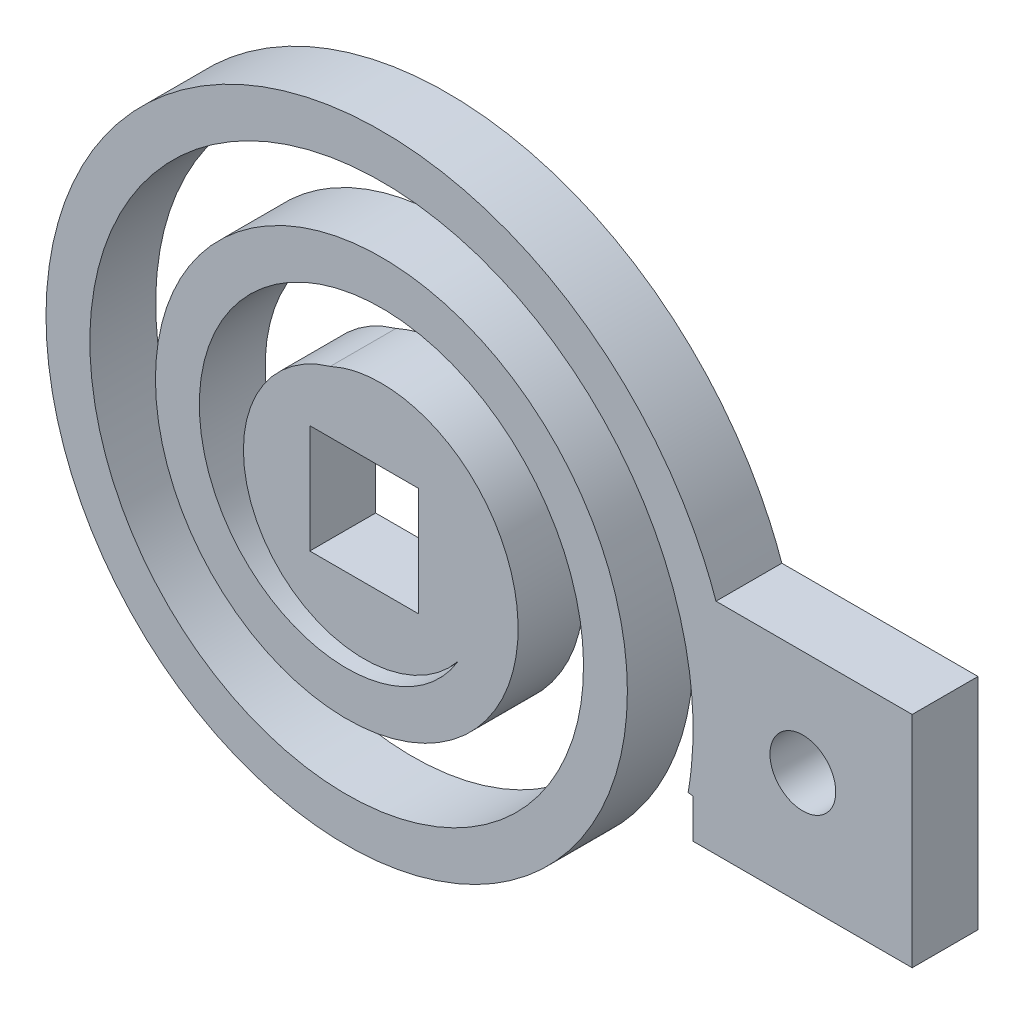
from build123d import *

# Parameters (mm, degrees)
BALAYAGE1_START  = -3
BALAYAGE1_DEPTH  = 3
ESQUISSE5_W      = 2
ESQUISSE5_H      = 3
EXTRUSION1_DEPTH = 4
ESQUISSE8_R      = 5.5
ESQUISSE8_W      = 10
ESQUISSE8_H      = 10
EXTRUSION2_DEPTH = 3
ESQUISSE9_R      = 1.5
ESQUISSE9_W      = 4.949747468
ESQUISSE9_H      = 4.949747468
EXTRUSION3_DEPTH = 30.683713673


# Read off the part's stored shape, not the designer's step: Balayage1
with BuildPart() as part:
    # Balayage1 outline → Balayage1 (new body)
    with BuildSketch(Plane.XY.offset(BALAYAGE1_START)):
        with BuildLine():
            Line((2.098663599, -0.46176203), (0.123522615, -0.776115481))
            add(Edge.make_bspline(
                [(0.123522615, -0.776115481), (0.119570945, -0.779541607), (0.116841063, -0.801624896), (0.0975614, -0.85668256), (0.079206465, -0.900433427), (0.019116685, -0.990384752), (-0.027528733, -1.045673964), (-0.148833871, -1.145674178), (-0.230781439, -1.197271691), (-0.421065415, -1.275060008), (-0.538243323, -1.305436912), (-0.790758643, -1.326771744), (-0.935598067, -1.31897245), (-1.229220073, -1.253335884), (-1.387268782, -1.193813973), (-1.688620492, -1.019723711), (-1.840120777, -0.900805212), (-2.107459984, -0.610094385), (-2.229719765, -0.431764496), (-2.418157895, -0.032288199), (-2.488450517, 0.196934301), (-2.555911758, 0.680543462), (-2.554573079, 0.943782939), (-2.467802028, 1.47147721), (-2.381161243, 1.744752711), (-2.121060571, 2.26448101), (-1.943848091, 2.518935205), (-1.509479191, 2.971801175), (-1.246401147, 3.176695335), (-0.657106892, 3.503349942), (-0.323357379, 3.62951923), (0.381344739, 3.777117066), (0.760753461, 3.800516307), (1.523625971, 3.729473328), (1.915709359, 3.634417198), (2.666460941, 3.324195536), (3.033148633, 3.105912639), (3.694926531, 2.55912899), (3.996734086, 2.225306189), (4.493840621, 1.469608999), (4.693974098, 1.040695902), (4.960043765, 0.128070209), (5.028521057, -0.363764724), (5.014307751, -1.360347881), (4.931658241, -1.873580254), (4.61158103, -2.865975608), (4.371707666, -3.353237249), (3.748391318, -4.245935559), (3.360245987, -4.658377544), (2.46646316, -5.357619951), (1.95429181, -5.649724951), (0.851952915, -6.073057278), (0.254001961, -6.207433387), (-0.969875767, -6.292747761), (-1.604148351, -6.244414658), (-2.844256393, -5.957530752), (-3.458267977, -5.717236422), (-4.600076718, -5.057175697), (-5.135167071, -4.633357133), (-6.065467866, -3.634654225), (-6.466455902, -3.053772655), (-7.084407032, -1.78543258), (-7.305134435, -1.090562799), (-7.532746496, 0.34841253), (-7.541061918, 1.100691911), (-7.332063144, 2.588948779), (-7.113730208, 3.33314777), (-6.459862064, 4.737214154), (-6.020956025, 5.404634726), (-4.954957034, 6.590878731), (-4.322442528, 7.115931984), (-2.917267116, 7.963174424), (-2.137612246, 8.289732511), (-0.501776106, 8.701331307), (0.362358472, 8.788506009), (2.093045811, 8.702728757), (2.967817072, 8.529497227), (4.641513018, 7.927111256), (5.448206615, 7.495295061), (6.910356841, 6.403524808), (7.572459382, 5.73876477), (8.680010792, 4.231076997), (9.130408706, 3.381622214), (9.76561158, 1.573173827), (9.95324376, 0.606503192), (10.035726085, -1.354509225), (9.931041877, -2.357008956), (9.426948831, -4.301461932), (9.025609686, -5.251345241), (7.952829611, -7.003776092), (7.277235745, -7.813338755), (5.706063134, -9.207749507), (4.804474226, -9.798091865), (2.853462563, -10.693548247), (1.796697699, -11.002163126), (-0.376105069, -11.296732523), (-1.500177774, -11.283895775), (-3.709980792, -10.925568218), (-4.803740998, -10.578894532), (-6.854724832, -9.572361265), (-7.819278008, -8.909034981), (-9.521935421, -7.317542409), (-10.266035733, -6.383930779), (-11.454604136, -4.3258554), (-11.903218608, -3.194443355), (-12.45160679, -0.834708368), (-12.553322213, 0.401461217), (-12.388017152, 2.864527266), (-12.12057028, 4.099487786), (-11.22923579, 6.450809979), (-10.602595453, 7.574754921), (-9.03742655, 9.601290037), (-8.094061797, 10.510327624), (-5.969408245, 12.02032189), (-4.781622291, 12.626034709), (-2.265903389, 13.467024105), (-0.930377516, 13.704957558), (1.76716748, 13.778832184), (3.137216572, 13.615105325), (5.783909405, 12.888773647), (7.068325029, 12.324151677), (9.428118855, 10.834695215), (10.510339467, 9.905673332), (12.364847373, 7.759349174), (13.142457911, 6.536055333), (14.311068079, 3.901043082), (14.705414555, 2.482050155), (15.062646927, -0.424595604), (15.026622205, -1.920145212), (14.770844841, -3.385270744)],
                knots=[0, 0, 0, 0, 0.015625, 0.015625, 0.03125, 0.03125, 0.046875, 0.046875, 0.0625, 0.0625, 0.078125, 0.078125, 0.09375, 0.09375, 0.109375, 0.109375, 0.125, 0.125, 0.140625, 0.140625, 0.15625, 0.15625, 0.171875, 0.171875, 0.1875, 0.1875, 0.203125, 0.203125, 0.21875, 0.21875, 0.234375, 0.234375, 0.25, 0.25, 0.265625, 0.265625, 0.28125, 0.28125, 0.296875, 0.296875, 0.3125, 0.3125, 0.328125, 0.328125, 0.34375, 0.34375, 0.359375, 0.359375, 0.375, 0.375, 0.390625, 0.390625, 0.40625, 0.40625, 0.421875, 0.421875, 0.4375, 0.4375, 0.453125, 0.453125, 0.46875, 0.46875, 0.484375, 0.484375, 0.5, 0.5, 0.515625, 0.515625, 0.53125, 0.53125, 0.546875, 0.546875, 0.5625, 0.5625, 0.578125, 0.578125, 0.59375, 0.59375, 0.609375, 0.609375, 0.625, 0.625, 0.640625, 0.640625, 0.65625, 0.65625, 0.671875, 0.671875, 0.6875, 0.6875, 0.703125, 0.703125, 0.71875, 0.71875, 0.734375, 0.734375, 0.75, 0.75, 0.765625, 0.765625, 0.78125, 0.78125, 0.796875, 0.796875, 0.8125, 0.8125, 0.828125, 0.828125, 0.84375, 0.84375, 0.859375, 0.859375, 0.875, 0.875, 0.890625, 0.890625, 0.90625, 0.90625, 0.921875, 0.921875, 0.9375, 0.9375, 0.953125, 0.953125, 0.96875, 0.96875, 0.984375, 0.984375, 1, 1, 1, 1], degree=3))
            Line((14.770844841, -3.385270744), (16.748248511, -3.685061879))
            add(Edge.make_bspline(
                [(2.098663599, -0.46176203), (2.129630148, -0.684585885), (2.124981067, -0.923442707), (2.032372753, -1.408017477), (1.944357309, -1.653637163), (1.681879935, -2.122339402), (1.507396908, -2.345307697), (1.079148696, -2.738502757), (0.825401597, -2.908611426), (0.25614759, -3.16862501), (-0.059302074, -3.25842113), (-0.725219387, -3.336556884), (-1.075594964, -3.32480968), (-1.777671245, -3.187808192), (-2.129253363, -3.062499824), (-2.796304814, -2.697687681), (-3.111640586, -2.458170298), (-3.668857568, -1.876659015), (-3.910603908, -1.534695699), (-4.287488846, -0.772173533), (-4.422505689, -0.35168863), (-4.560882855, 0.533413521), (-4.564148235, 0.997918916), (-4.425388678, 1.928836294), (-4.283307124, 2.395108212), (-3.853955788, 3.283399666), (-3.566675767, 3.705264013), (-2.861798087, 4.459140797), (-2.444240189, 4.790998192), (-1.508011543, 5.324545488), (-0.989429201, 5.526096466), (0.107246046, 5.768480082), (0.685208295, 5.809204987), (1.849965689, 5.712914668), (2.436598914, 5.575835505), (3.563389104, 5.123070388), (4.103367543, 4.807373056), (5.082083612, 4.013821808), (5.520643115, 3.536012968), (6.247728365, 2.451509539), (6.536094129, 1.844914914), (6.925119862, 0.550740613), (7.025654742, -0.136691305), (7.016814166, -1.533764336), (6.907362573, -2.243222035), (6.47488662, -3.619722817), (6.151844946, -4.286563016), (5.308506267, -5.513226761), (4.78825532, -6.072846763), (3.586375818, -7.026670398), (2.904855264, -7.420689522), (1.433548891, -7.997019971), (0.643925514, -8.179184523), (-0.97733681, -8.302669946), (-1.808771957, -8.243897631), (-3.439827853, -7.877191544), (-4.23922106, -7.569229534), (-5.731333916, -6.718507483), (-6.423822908, -6.175789759), (-7.633203283, -4.892405344), (-8.149882667, -4.151850618), (-8.95138808, -2.529799829), (-9.236041646, -1.648477802), (-9.535761532, 0.182272453), (-9.550712884, 1.131478345), (-9.296199226, 3.015345563), (-9.026689972, 3.949755139), (-8.213767995, 5.718760713), (-7.670388822, 6.553097944), (-6.345763661, 8.0418278), (-5.564629037, 8.695978556), (-3.823870373, 9.75695395), (-2.864428233, 10.163576853), (-0.845333633, 10.681614692), (0.214080538, 10.792888374), (2.342309281, 10.697071429), (3.410849113, 10.489915481), (5.46177438, 9.761965032), (6.443872679, 9.241190079), (8.230148699, 7.919324843), (9.034052951, 7.11834035), (10.384483216, 5.296092615), (10.930775147, 4.275014832), (11.706551085, 2.094924245), (11.935863368, 0.936162398), (12.044457026, -1.421260098), (11.923647036, -2.619625001), (11.3289944, -4.950819408), (10.855151951, -6.083333913), (9.583059171, -8.17926816), (8.784903756, -9.142381809), (6.923012596, -10.807265762), (5.859461049, -11.508767149), (3.551588111, -12.578230665), (2.307526403, -12.945986834), (-0.25729886, -13.303042975), (-1.577748397, -13.292220788), (-4.180725436, -12.879483778), (-5.462911367, -12.477544444), (-7.874132319, -11.304465597), (-9.002828349, -10.533404592), (-11.001571984, -8.67770551), (-11.871314001, -7.593245109), (-13.26617953, -5.196231204), (-13.791059582, -3.883941553), (-14.438109518, -1.139926653), (-14.560122009, 0.291469773), (-14.377328689, 3.150854227), (-14.072468392, 4.578476193), (-13.04904344, 7.303825942), (-12.330535215, 8.601182345), (-10.530143415, 10.947070634), (-9.448425381, 11.995259143), (-7.005809409, 13.742296031), (-5.645174401, 14.440860776), (-2.756299599, 15.416082195), (-1.228399282, 15.692542216), (1.865183386, 15.786244103), (3.430478047, 15.603396444), (6.461810962, 14.780797253), (7.927446768, 14.14107437), (10.627202402, 12.447610857), (11.860940713, 11.394017754), (13.981328239, 8.953619846), (14.867651634, 7.56707148), (16.205073248, 4.573376393), (16.655932023, 2.966575004), (17.070324415, -0.332325267), (17.033728693, -2.024018404), (16.748248511, -3.685061879)],
                knots=[0, 0, 0, 0, 0.015625, 0.015625, 0.03125, 0.03125, 0.046875, 0.046875, 0.0625, 0.0625, 0.078125, 0.078125, 0.09375, 0.09375, 0.109375, 0.109375, 0.125, 0.125, 0.140625, 0.140625, 0.15625, 0.15625, 0.171875, 0.171875, 0.1875, 0.1875, 0.203125, 0.203125, 0.21875, 0.21875, 0.234375, 0.234375, 0.25, 0.25, 0.265625, 0.265625, 0.28125, 0.28125, 0.296875, 0.296875, 0.3125, 0.3125, 0.328125, 0.328125, 0.34375, 0.34375, 0.359375, 0.359375, 0.375, 0.375, 0.390625, 0.390625, 0.40625, 0.40625, 0.421875, 0.421875, 0.4375, 0.4375, 0.453125, 0.453125, 0.46875, 0.46875, 0.484375, 0.484375, 0.5, 0.5, 0.515625, 0.515625, 0.53125, 0.53125, 0.546875, 0.546875, 0.5625, 0.5625, 0.578125, 0.578125, 0.59375, 0.59375, 0.609375, 0.609375, 0.625, 0.625, 0.640625, 0.640625, 0.65625, 0.65625, 0.671875, 0.671875, 0.6875, 0.6875, 0.703125, 0.703125, 0.71875, 0.71875, 0.734375, 0.734375, 0.75, 0.75, 0.765625, 0.765625, 0.78125, 0.78125, 0.796875, 0.796875, 0.8125, 0.8125, 0.828125, 0.828125, 0.84375, 0.84375, 0.859375, 0.859375, 0.875, 0.875, 0.890625, 0.890625, 0.90625, 0.90625, 0.921875, 0.921875, 0.9375, 0.9375, 0.953125, 0.953125, 0.96875, 0.96875, 0.984375, 0.984375, 1, 1, 1, 1], degree=3))
        make_face()
    extrude(amount=BALAYAGE1_DEPTH)

    # Esquisse5 → Extrusion1 (add)
    with BuildSketch(Plane(origin=(0.123522615, -0.776115481, 0), x_dir=(0.9875704921513923, 0.15717672547758813, 0), z_dir=(-0.15717672547758813, 0.9875704921513923, 0))):
        with Locations((1, 1.5)):
            Rectangle(ESQUISSE5_W, ESQUISSE5_H)
    extrude(amount=EXTRUSION1_DEPTH)

    # Esquisse8 → Extrusion2 (add)
    with BuildSketch(Plane.XY):
        Circle(ESQUISSE8_R)
        with Locations((19.983367447, -0.197740643)):
            Rectangle(ESQUISSE8_W, ESQUISSE8_H)
    extrude(amount=-EXTRUSION2_DEPTH)

    # Esquisse9 → Extrusion3 (cut, through all)
    with BuildSketch(Plane.XY):
        with Locations((20, 0)):
            Circle(ESQUISSE9_R)
        Rectangle(ESQUISSE9_W, ESQUISSE9_H)
    extrude(amount=-EXTRUSION3_DEPTH, mode=Mode.SUBTRACT)


solid = part.part
